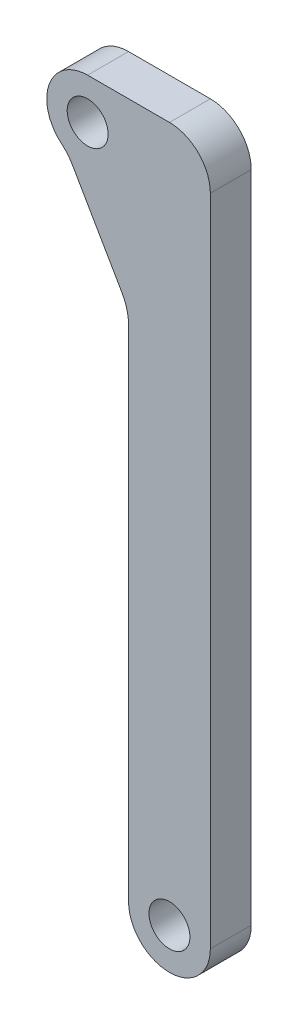
from build123d import *

# Parameters (mm, degrees)
SKETCH1_R           = 3.175
BOSS_EXTRUDE1_DEPTH = 6.35
CHAMFER1_START      = 34.302216058
CHAMFER1_OUTLINE_W  = 19.05
CHAMFER1_OUTLINE_H  = 6.35
CHAMFER1_DEPTH      = 8.674261314
FILLET1_R           = 7.62


with BuildPart() as part:
    # Sketch1 → Boss-Extrude1 (new body)
    with BuildSketch(Plane.XY):
        with BuildLine():
            Line((-6.35, 0), (-6.35, 95.25))
            Line((-6.35, 95.25), (-12.7, 95.25))
            ThreePointArc((-12.7, 95.25), (-19.05, 101.6), (-12.7, 107.95))
            Line((-12.7, 107.95), (0, 107.95))
            ThreePointArc((0, 107.95), (4.490128061, 106.090128061), (6.35, 101.6))
            Line((6.35, 101.6), (6.35, 0))
            ThreePointArc((6.35, 0), (0, -6.35), (-6.35, 0))
        make_face()
        Circle(SKETCH1_R, mode=Mode.SUBTRACT)
        with Locations((-12.7, 101.6)):
            Circle(SKETCH1_R, mode=Mode.SUBTRACT)
    extrude(amount=BOSS_EXTRUDE1_DEPTH)

    # Chamfer1: read off the stored shape, not the designer's step
    # Chamfer1 outline → Chamfer1 (add)
    with BuildSketch(Plane(origin=(0, 0, 0), x_dir=(0.49999999999999195, -0.8660254037844434, 0), z_dir=(0.8660254037844433, 0.4999999999999921, 0)).offset(CHAMFER1_START)):
        with Locations((-81.638181024, -3.175)):
            Rectangle(CHAMFER1_OUTLINE_W, CHAMFER1_OUTLINE_H)
    extrude(amount=CHAMFER1_DEPTH)

    # Fillet1
    fillet1_edges = [part.edges().sort_by_distance(p)[0] for p in [
        (-6.35, 79.602954743, 3.175),
        (-15.875, 96.100738686, 3.175),
    ]]
    fillet(fillet1_edges, radius=FILLET1_R)


solid = part.part
